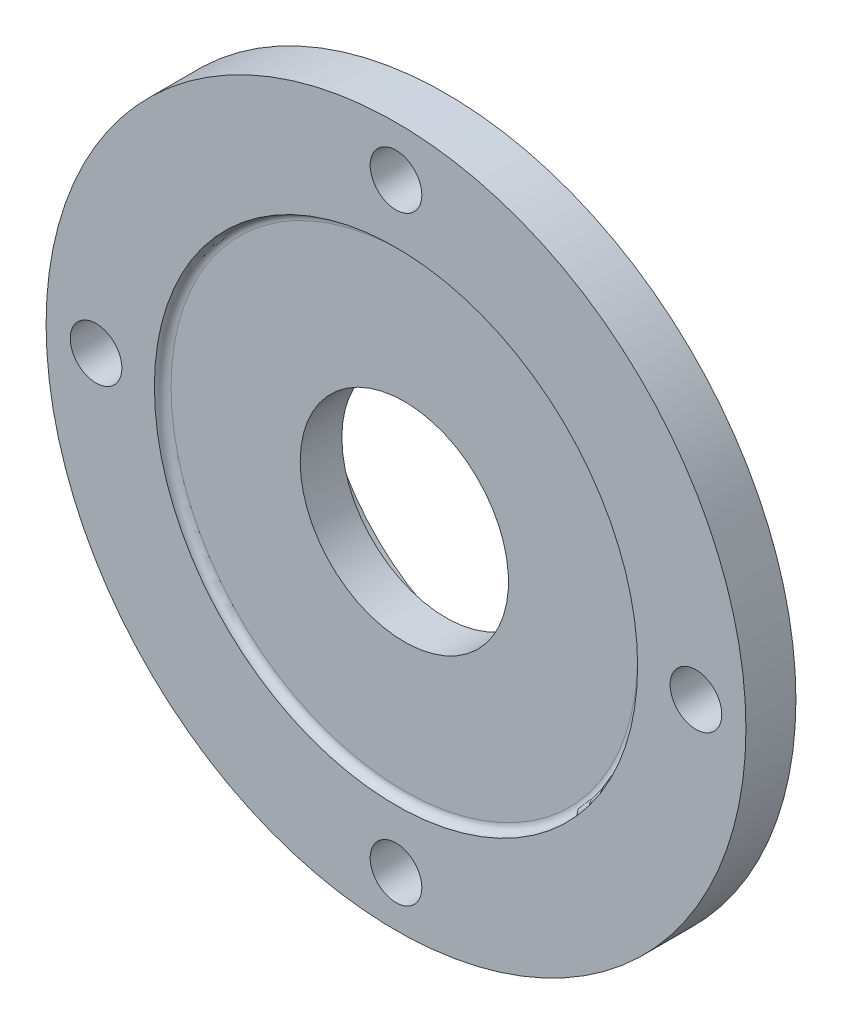
from build123d import *

# Parameters (mm, degrees)
SKETCH_1_R          = 42
SKETCH_1_R_2        = 3.1
EXTRUDE_1_DEPTH     = 6
SKETCH_2_R          = 29
CUT_EXTRUDE_1_DEPTH = 1
FILLET_3_R          = 1
SKETCH_3_R          = 29
SKETCH_3_R_2        = 23.5
EXTRUDE_2_DEPTH     = 8.3
CHAMFER_1_SIZE      = 1
SKETCH_4_R          = 12.5
CUT_EXTRUDE_2_DEPTH = 8.3


with BuildPart() as part:
    # Эскиз1 → Бобышка-Вытянуть1 (new body)
    with BuildSketch(Plane.XY):
        Circle(SKETCH_1_R)
        with Locations((0, 36)):
            Circle(SKETCH_1_R_2, mode=Mode.SUBTRACT)
        with Locations((36, 0)):
            Circle(SKETCH_1_R_2, mode=Mode.SUBTRACT)
        with Locations((0, -36)):
            Circle(SKETCH_1_R_2, mode=Mode.SUBTRACT)
        with Locations((-36, 0)):
            Circle(SKETCH_1_R_2, mode=Mode.SUBTRACT)
    extrude(amount=EXTRUDE_1_DEPTH)

    # Эскиз2 → Вырез-Вытянуть1 (cut)
    with BuildSketch(Plane.XY.offset(6)):
        Circle(SKETCH_2_R)
    extrude(amount=-CUT_EXTRUDE_1_DEPTH, mode=Mode.SUBTRACT)

    # Скругление3
    fillet_3_edges = [part.edges().sort_by_distance(p)[0] for p in [
        (-29, 0, 5),
    ]]
    fillet(fillet_3_edges, radius=FILLET_3_R - 0.0001)  # a hair under: the kernel refuses the full size

    # Эскиз3 → Бобышка-Вытянуть2 (add)
    with BuildSketch(Plane(origin=(0, 0, 0), x_dir=(-1, 0, 0), z_dir=(0, 0, -1))):
        with Locations(Location((0, 0, 0), (0, 0, 180))):
            Circle(SKETCH_3_R)
        with Locations(Location((0, 0, 0), (0, 0, 180))):
            Circle(SKETCH_3_R_2, mode=Mode.SUBTRACT)
    extrude(amount=EXTRUDE_2_DEPTH)

    # Фаска1
    chamfer_1_edges = [part.edges().sort_by_distance(p)[0] for p in [
        (-23.5, 0, 0),
    ]]
    chamfer(chamfer_1_edges, length=CHAMFER_1_SIZE)

    # Эскиз4 → Вырез-Вытянуть2 (cut)
    with BuildSketch(Plane(origin=(0, 0, 0), x_dir=(-1, 0, 0), z_dir=(0, 0, -1))):
        Circle(SKETCH_4_R)
    extrude(amount=-CUT_EXTRUDE_2_DEPTH, mode=Mode.SUBTRACT)


solid = part.part
